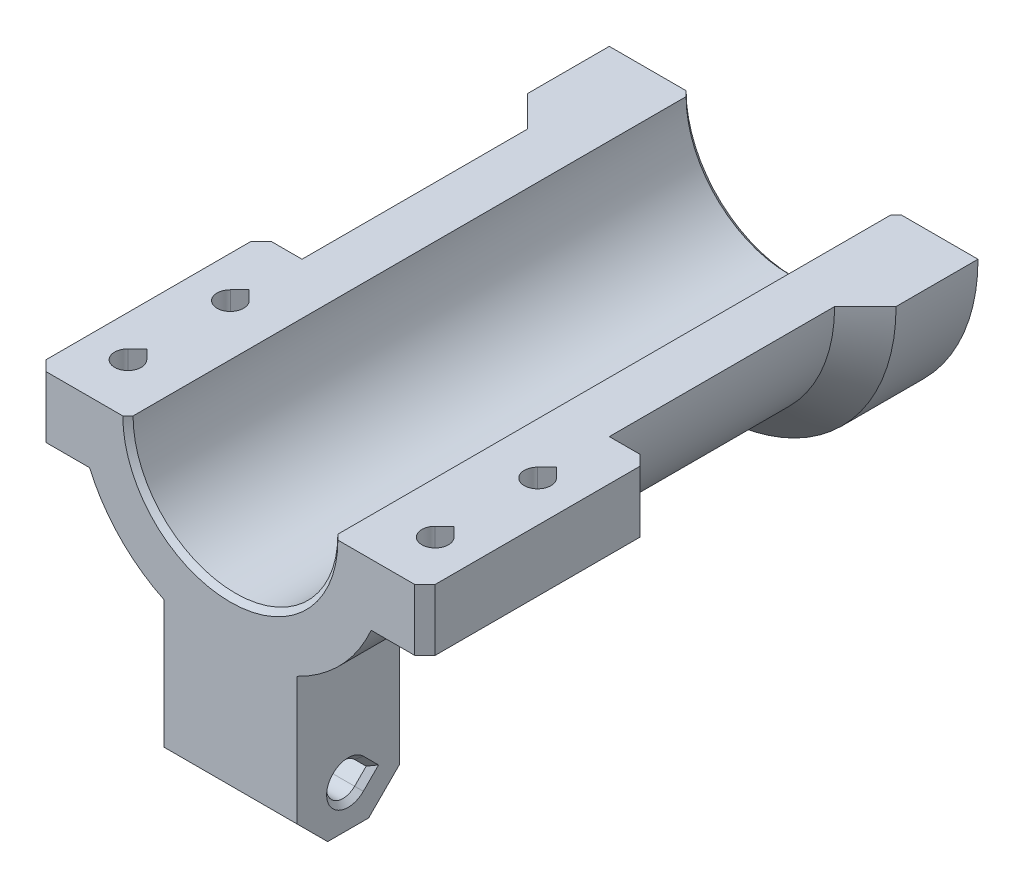
from build123d import *

# Parameters (mm, degrees)
EXTRUDE_1_DEPTH     = 10
CUT_EXTRUDE_1_DEPTH = 54
CUT_EXTRUDE_2_DEPTH = 54
EXTRUDE_START       = 45
EXTRUDE_2_DEPTH     = 45
CHAMFER_1_SIZE      = 3
EXTRUDE_START_2     = 12
EXTRUDE_3_DEPTH     = 12
CUT_EXTRUDE_4_DEPTH = 12
EXTRUDE_4_DEPTH     = 8
CHAMFER_7_SIZE      = 3
SKETCH_7_R          = 1.3
CUT_EXTRUDE_3_DEPTH = 10
CHAMFER_4_SIZE      = 1
CHAMFER_5_SIZE      = 0.5
CHAMFER_6_SIZE      = 0.5


with BuildPart() as part:
    # 草图1 → 凸台-拉伸1 (new body)
    with BuildSketch(Plane.XY):
        with BuildLine():
            Line((-10, 0), (-19, 0))
            Line((-19, 0), (-19, -6))
            Line((-19, -6), (-13.747727085, -6))
            ThreePointArc((-13.747727085, -6), (-10.799286806, -10.410350834), (-6.5, -13.518505835))
            Line((-6.5, -13.518505835), (-6.5, -29))
            Line((-6.5, -29), (6.5, -29))
            Line((6.5, -29), (6.5, -13.518505835))
            ThreePointArc((6.5, -13.518505835), (10.799286806, -10.410350834), (13.747727085, -6))
            Line((13.747727085, -6), (19, -6))
            Line((19, -6), (19, 0))
            Line((19, 0), (10, 0))
            ThreePointArc((10, 0), (0, -10), (-10, 0))
        make_face()
    extrude(amount=EXTRUDE_1_DEPTH)

    # 草图3 → 切除-拉伸1 (cut)
    with BuildSketch(Plane(origin=(6.5, 0, 0), x_dir=(0, 0, -1), z_dir=(1, 0, 0))):
        with BuildLine():
            Line((-3.86862915, -23.86862915), (-2.7372583, -25))
            Line((-2.7372583, -25), (-3.86862915, -26.13137085))
            ThreePointArc((-3.86862915, -26.13137085), (-6.6, -25), (-3.86862915, -23.86862915))
        make_face()
    extrude(amount=-CUT_EXTRUDE_1_DEPTH, mode=Mode.SUBTRACT)

    # 草图4 → 切除-拉伸2 (cut)
    with BuildSketch(Plane(origin=(0, 0, 0), x_dir=(1, 0, 0), z_dir=(0, 1, 0))):
        with BuildLine():
            Line((-15, -3.161522369), (-15.919238816, -4.080761184))
            ThreePointArc((-15.919238816, -4.080761184), (-15, -6.3), (-14.080761184, -4.080761184))
            Line((-14.080761184, -4.080761184), (-15, -3.161522369))
        make_face()
        with BuildLine():
            Line((15, -3.161522369), (14.080761184, -4.080761184))
            ThreePointArc((14.080761184, -4.080761184), (15, -6.3), (15.919238816, -4.080761184))
            Line((15.919238816, -4.080761184), (15, -3.161522369))
        make_face()
    extrude(amount=-CUT_EXTRUDE_2_DEPTH, mode=Mode.SUBTRACT)

    # 草图5 → 凸台-拉伸2 (add)
    with BuildSketch(Plane(origin=(0, 0, 0), x_dir=(-1, 0, 0), z_dir=(0, 0, -1)).offset(EXTRUDE_START)):
        with BuildLine():
            Line((10, 0), (15, 0))
            ThreePointArc((15, 0), (0, -15), (-15, 0))
            Line((-15, 0), (-10, 0))
            ThreePointArc((-10, 0), (0, -10), (10, 0))
        make_face()
    extrude(amount=-EXTRUDE_2_DEPTH)

    # 倒角1
    chamfer_1_edges = [part.edges().sort_by_distance(p)[0] for p in [
        (0, -29, 0),
        (0, -29, 10),
    ]]
    chamfer(chamfer_1_edges, length=CHAMFER_1_SIZE)

    # 草图8 → 凸台-拉伸3 (add)
    with BuildSketch(Plane(origin=(0, 0, 0), x_dir=(-1, 0, 0), z_dir=(0, 0, -1)).offset(EXTRUDE_START_2)):
        with BuildLine():
            Line((-15, 0), (-19, 0))
            Line((-19, 0), (-19, -6))
            Line((-19, -6), (-13.747727085, -6))
            ThreePointArc((-13.747727085, -6), (-14.683594694, -3.064644655), (-15, 0))
        make_face()
        with BuildLine():
            Line((13.747727085, -6), (19, -6))
            Line((19, -6), (19, 0))
            Line((19, 0), (15, 0))
            ThreePointArc((15, 0), (14.683594694, -3.064644655), (13.747727085, -6))
        make_face()
    extrude(amount=-EXTRUDE_3_DEPTH)

    # 草图9 → 切除-拉伸4 (cut)
    with BuildSketch(Plane(origin=(0, 0, 0), x_dir=(1, 0, 0), z_dir=(0, 1, 0))):
        with BuildLine():
            Line((15, 6.838477631), (14.080761184, 5.919238816))
            ThreePointArc((14.080761184, 5.919238816), (15, 3.7), (15.919238816, 5.919238816))
            Line((15.919238816, 5.919238816), (15, 6.838477631))
        make_face()
        with BuildLine():
            Line((-15, 6.838477631), (-15.919238816, 5.919238816))
            ThreePointArc((-15.919238816, 5.919238816), (-15, 3.7), (-14.080761184, 5.919238816))
            Line((-14.080761184, 5.919238816), (-15, 6.838477631))
        make_face()
    extrude(amount=-CUT_EXTRUDE_4_DEPTH, mode=Mode.SUBTRACT)

    # 草图10 → 凸台-拉伸4 (add)
    with BuildSketch(Plane(origin=(0, 0, -45), x_dir=(-1, 0, 0), z_dir=(0, 0, -1))):
        with BuildLine():
            Line((-15, 0), (-18, 0))
            ThreePointArc((-18, 0), (0, -18), (18, 0))
            Line((18, 0), (15, 0))
            ThreePointArc((15, 0), (0, -15), (-15, 0))
        make_face()
    extrude(amount=-EXTRUDE_4_DEPTH)

    # 倒角7
    chamfer_7_edges = [part.edges().sort_by_distance(p)[0] for p in [
        (0, -15, -37),
    ]]
    chamfer(chamfer_7_edges, length=CHAMFER_7_SIZE - 0.0001)  # a hair under: the kernel refuses the full size

    # 草图7 → 切除-拉伸3 (cut)
    with BuildSketch(Plane(origin=(0, 0, -45), x_dir=(-1, 0, 0), z_dir=(0, 0, -1))):
        with Locations((-9.899494937, -9.899494937)):
            Circle(SKETCH_7_R)
        with Locations(Location((9.899494937, -9.899494937, 0), (0, 0, 180))):
            Circle(SKETCH_7_R)
    extrude(amount=-CUT_EXTRUDE_3_DEPTH, mode=Mode.SUBTRACT)

    # 倒角4
    chamfer_4_edges = [part.edges().sort_by_distance(p)[0] for p in [
        (-19, -3, 10),
        (19, -3, -12),
        (-19, -3, -12),
        (19, -3, 10),
    ]]
    chamfer(chamfer_4_edges, length=CHAMFER_4_SIZE)

    # 倒角5
    chamfer_5_edges = [part.edges().sort_by_distance(p)[0] for p in [
        (-6.5, -25, 6.6),
        (-6.5, -24.434314575, 3.302943725),
        (-6.5, -25.565685425, 3.302943725),
        (6.5, -25, 6.6),
        (6.5, -25.565685425, 3.302943725),
        (6.5, -24.434314575, 3.302943725),
        (0, -10, 10),
        (0, -10, -45),
    ]]
    chamfer(chamfer_5_edges, length=CHAMFER_5_SIZE)

    # 倒角6
    chamfer_6_edges = [part.edges().sort_by_distance(p)[0] for p in [
        (11.199494937, -9.899494937, -35),
        (11.199494937, -9.899494937, -45),
        (-11.199494937, -9.899494937, -35),
        (-11.199494937, -9.899494937, -45),
    ]]
    chamfer(chamfer_6_edges, length=CHAMFER_6_SIZE)


solid = part.part
